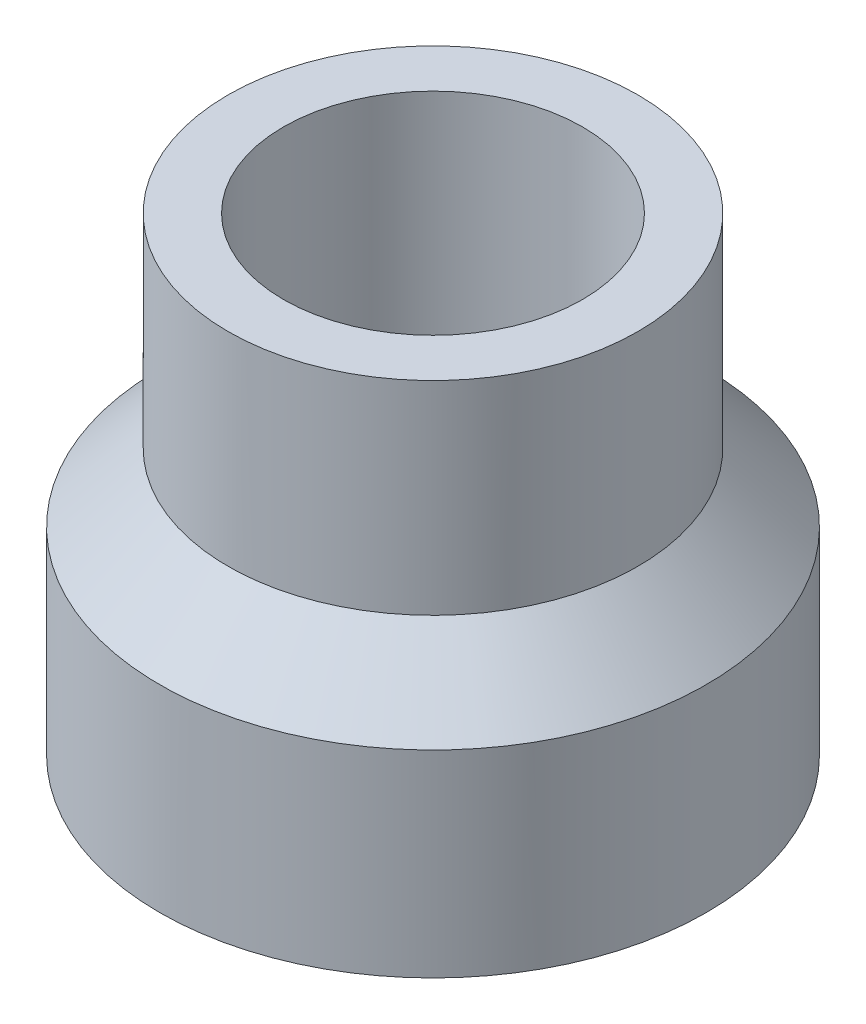
from build123d import *

# Parameters (mm, degrees)
SKETCH1_R           = 6.35
SKETCH1_R_2         = 4.7625
BOSS_EXTRUDE1_DEPTH = 3.175
SKETCH1_3_R         = 4.7625
SKETCH1_3_R_2       = 3.475
BOSS_EXTRUDE2_DEPTH = 10.9
CHAMFER1_SIZE       = 3


with BuildPart() as part:
    # Sketch1 → Boss-Extrude1 (new body)
    with BuildSketch(Plane(origin=(0, 0, 0), x_dir=(1, 0, 0), z_dir=(0, 1, 0))):
        with Locations(Location((0, 0, 0), (0, 0, 270))):
            Circle(SKETCH1_R)
        with Locations(Location((0, 0, 0), (0, 0, 270))):
            Circle(SKETCH1_R_2, mode=Mode.SUBTRACT)
    extrude(amount=BOSS_EXTRUDE1_DEPTH)

    # Sketch1<3> → Boss-Extrude2 (add)
    with BuildSketch(Plane(origin=(0, 0, 0), x_dir=(1, 0, 0), z_dir=(0, 1, 0))):
        with Locations(Location((0, 0, 0), (0, 0, 270))):
            Circle(SKETCH1_3_R)
        with Locations(Location((0, 0, 0), (0, 0, 270))):
            Circle(SKETCH1_3_R_2, mode=Mode.SUBTRACT)
    extrude(amount=BOSS_EXTRUDE2_DEPTH)

    # Chamfer1
    # the kernel refuses this chamfer: 3 mm, written as the material it adds along each edge
    with BuildSketch(Plane(origin=(0, 3.175, 0), x_dir=(0, 0, 1), z_dir=(-1, 0, 0))) as chamfer1_piece_1_section:
        Polygon((4.7625 + CHAMFER1_SIZE, 0), (4.7625, CHAMFER1_SIZE), (4.7625, 0), align=None)
    chamfer1_piece_1 = revolve(axis=Axis((0, 3.175, 0), (0, 1, 0)), mode=Mode.PRIVATE)
    chamfer1_piece_1 = chamfer1_piece_1 & Plane(origin=(0, 5.38786909, 0), x_dir=(0, 0, 1), z_dir=(0, -1, 0)) * Cylinder(6.35, 32, mode=Mode.PRIVATE)
    add(chamfer1_piece_1)


solid = part.part
